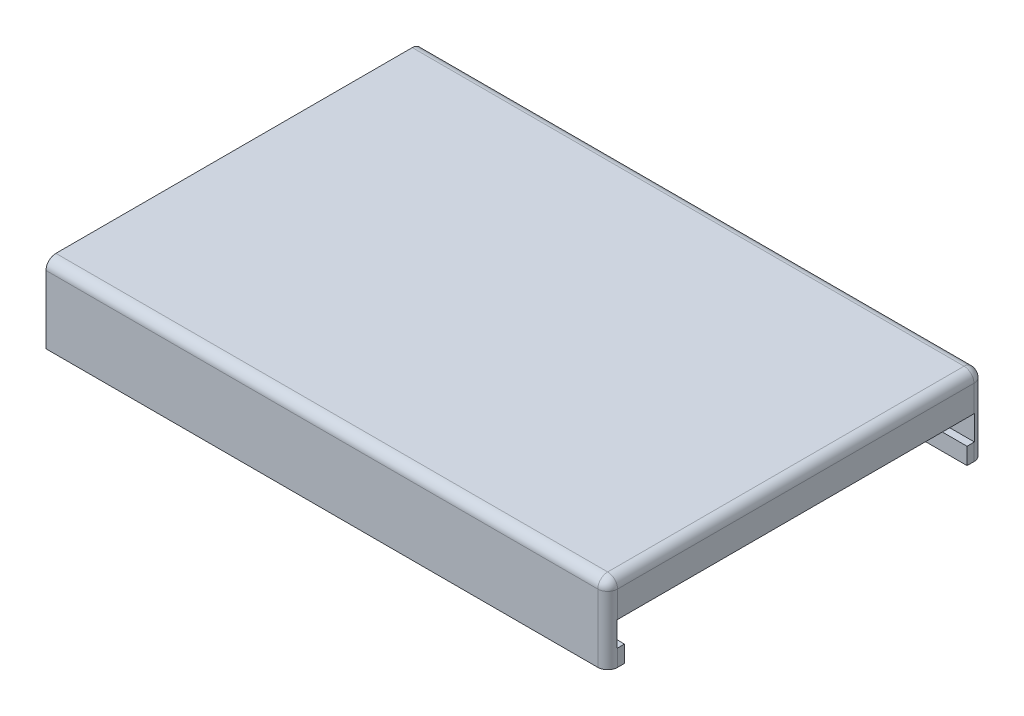
from build123d import *

# Parameters (mm, degrees)
SKETCH1_W           = 56.896
SKETCH1_H           = 38.1
BOSS_EXTRUDE1_DEPTH = 3.937
CUT_EXTRUDE1_DEPTH  = 61.12950428
FILLET1_R           = 1
SKETCH3_W           = 34.767886748
SKETCH3_H           = 4.174
CUT_EXTRUDE2_DEPTH  = 54.896


with BuildPart() as part:
    # Sketch1 → Boss-Extrude1 (new, symmetric)
    with BuildSketch(Plane(origin=(0, 0, 0), x_dir=(1, 0, 0), z_dir=(0, 1, 0))):
        Rectangle(SKETCH1_W, SKETCH1_H)
    extrude(amount=BOSS_EXTRUDE1_DEPTH, both=True)

    # Sketch2 → Cut-Extrude1 (cut, through all)
    with BuildSketch(Plane(origin=(28.448, 0, 0), x_dir=(0, 0, -1), z_dir=(1, 0, 0))):
        Polygon((18.0975, -2.237), (18.0975, 0.263), (17.492836072, 0.263), (-17.492836072, 0.263), (-18.0975, 0.263), (-18.0975, -2.237), (-17.35, -2.237), (-17.35, -3.937), (17.35, -3.937), (17.35, -2.237), align=None)
    extrude(amount=-CUT_EXTRUDE1_DEPTH, mode=Mode.SUBTRACT)

    # Fillet1
    # the kernel refuses this fillet: 1 mm, written as the material it takes off along each edge
    with BuildSketch(Plane(origin=(27.448, 2.937, -18.05), x_dir=(1, 0, 0), z_dir=(0, 0, -1))) as fillet1_piece_1_section:
        Polygon((0, 0), (FILLET1_R, 0), (FILLET1_R, -FILLET1_R), (0, -FILLET1_R), align=None)
    fillet1_piece_1 = extrude(amount=FILLET1_R, mode=Mode.PRIVATE)
    fillet1_piece_1 = fillet1_piece_1 - Plane(origin=(27.448, 2.937, -18.05), x_dir=(-0.7071067811865475, -0.7071067811865475, 0), z_dir=(0, 0, -1)) * Sphere(FILLET1_R, mode=Mode.PRIVATE)
    add(fillet1_piece_1, mode=Mode.SUBTRACT)
    with BuildSketch(Plane(origin=(27.448, 2.937, 18.05), x_dir=(0, 1, 0), z_dir=(1, 0, 0))) as fillet1_piece_2_section:
        Polygon((0, 0), (FILLET1_R, 0), (FILLET1_R, FILLET1_R), (0, FILLET1_R), align=None)
    fillet1_piece_2 = extrude(amount=FILLET1_R, mode=Mode.PRIVATE)
    fillet1_piece_2 = fillet1_piece_2 - Plane(origin=(27.448, 2.937, 18.05), x_dir=(0, -0.7071067811865475, -0.7071067811865475), z_dir=(1, 0, 0)) * Sphere(FILLET1_R, mode=Mode.PRIVATE)
    add(fillet1_piece_2, mode=Mode.SUBTRACT)
    with BuildSketch(Plane(origin=(-30.948, 3.937, -19.05), x_dir=(0, -1, 0), z_dir=(1, 0, 0))) as fillet1_piece_3:
        with BuildLine():
            CenterArc((FILLET1_R, -FILLET1_R), FILLET1_R, 90, 90)
            Line((0, -FILLET1_R), (0, 0))
            Line((0, 0), (FILLET1_R, 0))
        make_face()
    extrude(amount=58.396, mode=Mode.SUBTRACT)
    with BuildSketch(Plane(origin=(28.448, 3.937, -18.05), x_dir=(0, -1, 0), z_dir=(0, 0, 1))) as fillet1_piece_4:
        with BuildLine():
            CenterArc((FILLET1_R, -FILLET1_R), FILLET1_R, 90, 90)
            Line((0, -FILLET1_R), (0, 0))
            Line((0, 0), (FILLET1_R, 0))
        make_face()
    extrude(amount=36.1, mode=Mode.SUBTRACT)
    with BuildSketch(Plane(origin=(27.448, 3.937, 19.05), x_dir=(0, 0, -1), z_dir=(-1, 0, 0))) as fillet1_piece_5:
        with BuildLine():
            CenterArc((FILLET1_R, FILLET1_R), FILLET1_R, 180, 90)
            Line((0, FILLET1_R), (0, 0))
            Line((0, 0), (FILLET1_R, 0))
        make_face()
    extrude(amount=58.396, mode=Mode.SUBTRACT)
    with BuildSketch(Plane(origin=(28.448, 2.937, -19.05), x_dir=(-1, 0, 0), z_dir=(0, -1, 0)), Plane(origin=(28.448, 2.937, 19.05), x_dir=(0, 0, -1), z_dir=(0, -1, 0))) as fillet1_piece_6:
        with BuildLine():
            CenterArc((FILLET1_R, -FILLET1_R), FILLET1_R, 90, 90)
            Line((0, -FILLET1_R), (0, 0))
            Line((0, 0), (FILLET1_R, 0))
        make_face()
    extrude(amount=9.374, mode=Mode.SUBTRACT)

    # Sketch3 → Cut-Extrude2 (cut)
    with BuildSketch(Plane.ZY.offset(28.448)):
        with Locations((0.033943374, -0.15)):
            Rectangle(SKETCH3_W, SKETCH3_H)
    extrude(amount=-CUT_EXTRUDE2_DEPTH, mode=Mode.SUBTRACT)


solid = part.part
